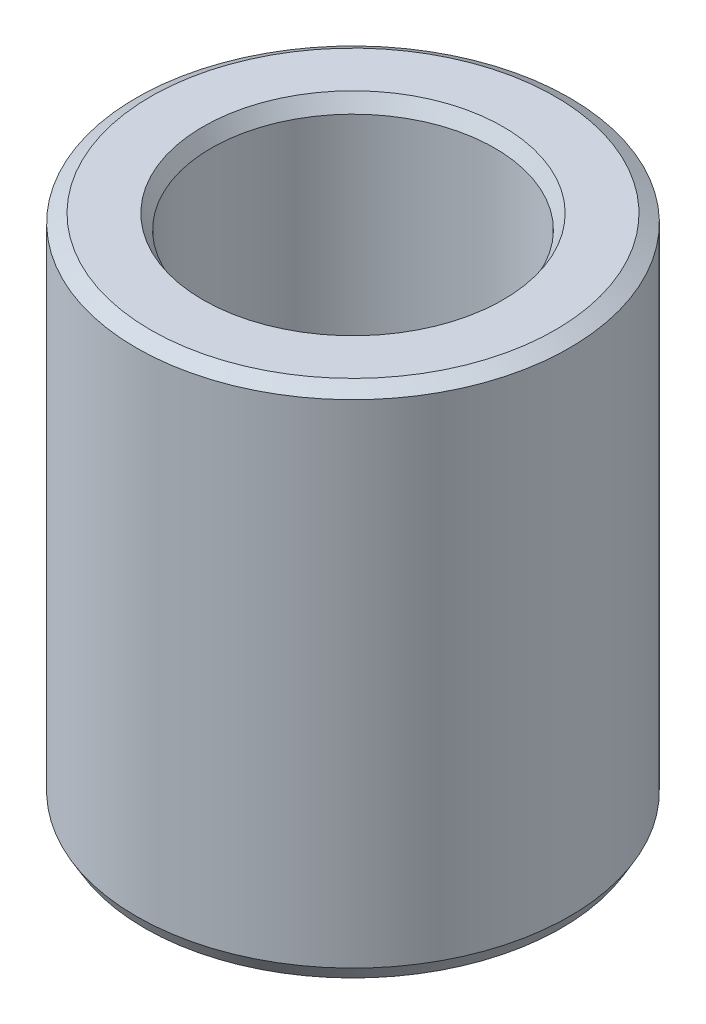
from build123d import *
from OCP.BRepFilletAPI import BRepFilletAPI_MakeChamfer

# Parameters (mm, degrees)
SKETCH1_R           = 55
BOSS_EXTRUDE1_DEPTH = 130.74175719
SKETCH2_R           = 35.980994308
CUT_EXTRUDE1_DEPTH  = 153.129573302
CHAMFER1_SIZE       = 2.109049169
CHAMFER1_SIZE2      = 3.652980316


with BuildPart() as part:
    # Sketch1 → Boss-Extrude1 (new body)
    with BuildSketch(Plane(origin=(0, 0, 0), x_dir=(1, 0, 0), z_dir=(0, 1, 0))):
        Circle(SKETCH1_R)
    extrude(amount=BOSS_EXTRUDE1_DEPTH)

    # Sketch2 → Cut-Extrude1 (cut, through all)
    with BuildSketch(Plane(origin=(0, 0, 0), x_dir=(1, 0, 0), z_dir=(0, 1, 0))):
        Circle(SKETCH2_R)
    extrude(amount=CUT_EXTRUDE1_DEPTH, mode=Mode.SUBTRACT)

    # Chamfer1: one chamfer whose edges measure the first distance from different faces: ONE call of the kernel's chamfer builder (chamfer() names one face for all edges)
    chamfer1_edges_1 = [part.edges().sort_by_distance(p)[0] for p in [
        (-35.980994308, 130.74175719, 0),
    ]]
    chamfer1_side_1 = [part.faces().sort_by_distance(p)[0] for p in [
        (-53.444365081, 130.74175719, 0),
    ]]
    chamfer1_edges_2 = [part.edges().sort_by_distance(p)[0] for p in [
        (-35.980994308, 0, 0),
    ]]
    chamfer1_side_2 = [part.faces().sort_by_distance(p)[0] for p in [
        (-35.980994308, 65.370878595, 0),
    ]]
    chamfer1_edges_3 = [part.edges().sort_by_distance(p)[0] for p in [
        (-55, 0, 0),
    ]]
    chamfer1_side_3 = [part.faces().sort_by_distance(p)[0] for p in [
        (-53.444365081, 0, 0),
    ]]
    chamfer1_edges_4 = [part.edges().sort_by_distance(p)[0] for p in [
        (-55, 130.74175719, 0),
    ]]
    chamfer1_side_4 = [part.faces().sort_by_distance(p)[0] for p in [
        (-55, 65.370878595, 0),
    ]]
    chamfer1 = BRepFilletAPI_MakeChamfer(part.part.solid().wrapped)
    for e in chamfer1_edges_1:
        chamfer1.Add(CHAMFER1_SIZE, CHAMFER1_SIZE2, e.wrapped, chamfer1_side_1[0].wrapped)  # the first distance lies on this face
    for e in chamfer1_edges_2:
        chamfer1.Add(CHAMFER1_SIZE, CHAMFER1_SIZE2, e.wrapped, chamfer1_side_2[0].wrapped)  # the first distance lies on this face
    for e in chamfer1_edges_3:
        chamfer1.Add(CHAMFER1_SIZE, CHAMFER1_SIZE2, e.wrapped, chamfer1_side_3[0].wrapped)  # the first distance lies on this face
    for e in chamfer1_edges_4:
        chamfer1.Add(CHAMFER1_SIZE, CHAMFER1_SIZE2, e.wrapped, chamfer1_side_4[0].wrapped)  # the first distance lies on this face
    add(Compound.cast(chamfer1.Shape()), mode=Mode.REPLACE)


solid = part.part
